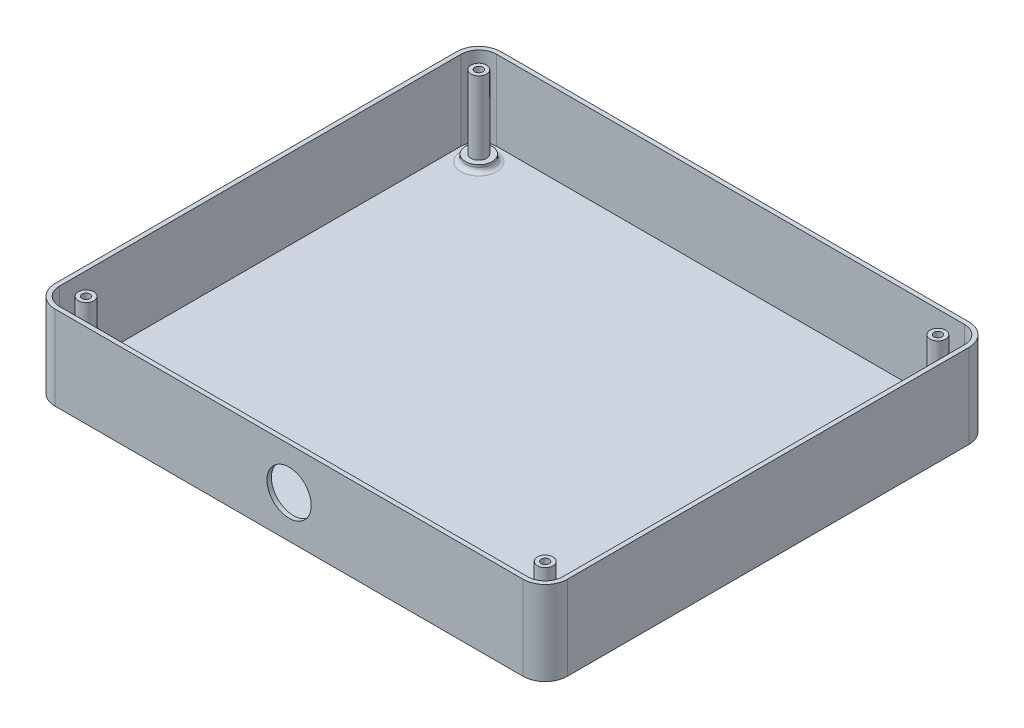
from build123d import *

# Parameters (mm, degrees)
SKETCH1_W            = 231.4
SKETCH1_H            = 201.4
BOSS_EXTRUDE1_DEPTH  = 38
FILLET1_R            = 10
SHELL1_T             = -2
SKETCH2_R            = 10
CUT_EXTRUDE1_DEPTH   = 2
SKETCH3_R            = 6
BOSS_EXTRUDE2_DEPTH  = 3
SKETCH4_R            = 3.5
SKETCH4_R_2          = 1.8
BOSS_EXTRUDE3_DEPTH  = 33
FILLET2_R            = 2
FILLET2_OF_MIRROR1_R = 2


# Read off the part's stored shape, not the designer's step: Mirror2
with BuildPart() as part:
    # Sketch1 → Boss-Extrude1 (new body)
    with BuildSketch(Plane(origin=(0, 0, 0), x_dir=(1, 0, 0), z_dir=(0, 1, 0))):
        Rectangle(SKETCH1_W, SKETCH1_H)
    extrude(amount=BOSS_EXTRUDE1_DEPTH)

    # Fillet1
    fillet1_edges = [part.edges().sort_by_distance(p)[0] for p in [
        (-115.7, 19, -100.7),
        (115.7, 19, -100.7),
        (115.7, 19, 100.7),
        (-115.7, 19, 100.7),
    ]]
    fillet(fillet1_edges, radius=FILLET1_R)

    # Shell1
    shell1_openings = [part.faces().sort_by_distance(p)[0] for p in [
        (0, 38, 0),
    ]]
    offset(amount=SHELL1_T, openings=shell1_openings, kind=Kind.INTERSECTION)

    # Sketch2 → Cut-Extrude1 (cut)
    with BuildSketch(Plane.XY.offset(100.7)):
        with Locations((0, 19)):
            Circle(SKETCH2_R)
    extrude(amount=-CUT_EXTRUDE1_DEPTH, mode=Mode.SUBTRACT)

    # Sketch3 → Boss-Extrude2 (add)
    with BuildSketch(Plane(origin=(0, 2, 0), x_dir=(1, 0, 0), z_dir=(0, 1, 0))):
        with Locations(Location((-103.7, 88.7, 0), (0, 0, 270))):
            Circle(SKETCH3_R)
    boss_extrude2 = extrude(amount=BOSS_EXTRUDE2_DEPTH)

    # Sketch4 → Boss-Extrude3 (add)
    with BuildSketch(Plane(origin=(0, 5, 0), x_dir=(1, 0, 0), z_dir=(0, 1, 0))):
        with Locations(Location((-103.7, 88.7, 0), (0, 0, 270))):
            Circle(SKETCH4_R)
        with Locations(Location((-103.7, 88.7, 0), (0, 0, 270))):
            Circle(SKETCH4_R_2, mode=Mode.SUBTRACT)
    boss_extrude3 = extrude(amount=BOSS_EXTRUDE3_DEPTH)

    # Fillet2
    fillet2_edges = [part.edges().sort_by_distance(p)[0] for p in [
        (-103.7, 2, -94.7),
    ]]
    fillet(fillet2_edges, radius=FILLET2_R)

    # Mirror1: Boss-Extrude2, Boss-Extrude3 across plane
    add(boss_extrude2.mirror(Plane(origin=(0, 0, 0), x_dir=(0, 0, 1), z_dir=(1, 0, 0))))
    add(boss_extrude3.mirror(Plane(origin=(0, 0, 0), x_dir=(0, 0, 1), z_dir=(1, 0, 0))))

    # Fillet2 of Mirror1
    fillet2_of_mirror1_edges = [part.edges().sort_by_distance(p)[0] for p in [
        (103.7, 2, -94.7),
    ]]
    fillet(fillet2_of_mirror1_edges, radius=FILLET2_OF_MIRROR1_R)

    # Mirror2 outline → Mirror2 (revolve)
    with BuildSketch(Plane(origin=(103.7, 0, 88.7), x_dir=(1, 0, 0), z_dir=(0, 0, 1))):
        with BuildLine():
            Line((3.5, 38), (1.8, 38))
            Line((1.8, 38), (1.8, 5))
            Line((1.8, 5), (0, 5))
            Line((0, 5), (0, 2))
            Line((0, 2), (8, 2))
            ThreePointArc((8, 2), (6.585786438, 2.585786438), (6, 4))
            Line((6, 4), (6, 5))
            Line((6, 5), (3.5, 5))
            Line((3.5, 5), (3.5, 38))
        make_face()
    revolve(axis=Axis((103.7, 0, 88.7), (0, 1, 0)))

    # Mirror2 2 outline → Mirror2 2 (revolve)
    with BuildSketch(Plane(origin=(-103.7, 0, 88.7), x_dir=(1, 0, 0), z_dir=(0, 0, 1))):
        with BuildLine():
            Line((3.5, 38), (1.8, 38))
            Line((1.8, 38), (1.8, 5))
            Line((1.8, 5), (0, 5))
            Line((0, 5), (0, 2))
            Line((0, 2), (8, 2))
            ThreePointArc((8, 2), (6.585786438, 2.585786438), (6, 4))
            Line((6, 4), (6, 5))
            Line((6, 5), (3.5, 5))
            Line((3.5, 5), (3.5, 38))
        make_face()
    revolve(axis=Axis((-103.7, 0, 88.7), (0, 1, 0)))


solid = part.part
